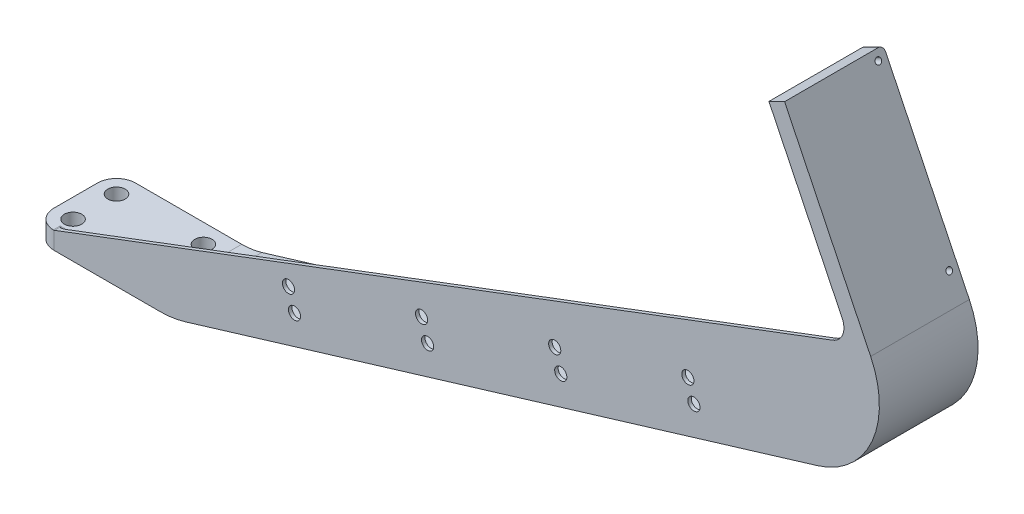
from build123d import *

# Parameters (mm, degrees)
SKETCH2_R            = 2.5000000000000004
SKETCH2_R_2          = 2.5000000000000018
BOSS_EXTRUDE1_DEPTH  = 2.5
SKETCH5_W            = 36
SKETCH5_H            = 5
SKETCH11_W           = 51.75
SKETCH11_H           = 51.75
SKETCH11_W_2         = 41.75000000000001
SKETCH11_H_2         = 41.75000000000001
BOSS_EXTRUDE2_DEPTH  = 5
SKETCH14_W           = 41.75000000000001
SKETCH14_H           = 41.75000000000003
BOSS_EXTRUDE3_DEPTH  = 1.5
FILLET1_R            = 8
SKETCH18_R           = 0.8750000000000002
CUT_EXTRUDE3_DEPTH   = 254.3041056928498
CUT_EXTRUDE4_START   = -26.0000001
CUT_EXTRUDE4_DEPTH   = 15.6250001
CUT_EXTRUDE4_START_2 = -2.5
CUT_EXTRUDE4_2_DEPTH = 88.820487138
CUT_EXTRUDE5_DEPTH   = 245.11833407729904
FILLET2_R            = 1.5
BOSS_EXTRUDE4_DEPTH  = 1
FILLET3_R            = 1
SKETCH22_R           = 1.7500000000000062
SKETCH22_R_2         = 1.750000000000084
CUT_EXTRUDE6_DEPTH   = 267.0706428279103
LPATTERN1_COUNT      = 4
LPATTERN1_PITCH      = 40
FILLET4_R            = 5


with BuildPart() as part:
    # Sketch2 → Boss-Extrude1 (new, symmetric)
    with BuildSketch(Plane(origin=(0, 0, 0), x_dir=(1, 0, 0), z_dir=(0, 1, 0))):
        with BuildLine():
            Line((-18.000000000000004, -12.5), (-18, 12.5))
            ThreePointArc((-18, 12.5), (-16.38908729652601, 16.38908729652601), (-12.5, 18.000000000000004))
            Line((-12.5, 18.000000000000004), (12.5, 17.999999999999996))
            Line((12.5, 17.999999999999996), (18.000000000000004, 17.999999999999996))
            Line((18.000000000000004, 17.999999999999996), (18.000000000000004, 12.5))
            Line((18.000000000000004, 12.5), (18.000000000000004, -12.5))
            Line((18.000000000000004, -12.5), (18.000000000000004, -18.000000000000004))
            Line((18.000000000000004, -18.000000000000004), (12.5, -18.000000000000004))
            Line((12.5, -18.000000000000004), (-12.5, -18.000000000000004))
            ThreePointArc((-12.5, -18.000000000000004), (-16.389087296526014, -16.389087296526014), (-18.000000000000004, -12.5))
        make_face()
        with Locations(Location((-12.5, 12.5, 0), (0, 0, 270))):
            Circle(SKETCH2_R, mode=Mode.SUBTRACT)
        with Locations(Location((12.5, 12.5, 0), (0, 0, 270))):
            Circle(SKETCH2_R_2, mode=Mode.SUBTRACT)
        with Locations(Location((12.5, -12.5, 0), (0, 0, 270))):
            Circle(SKETCH2_R_2, mode=Mode.SUBTRACT)
        with Locations(Location((-12.5, -12.5, 0), (0, 0, 270))):
            Circle(SKETCH2_R, mode=Mode.SUBTRACT)
        with Locations(Location((-12.5, 0, 0), (0, 0, 270))):
            Circle(SKETCH2_R, mode=Mode.SUBTRACT)
        with Locations(Location((12.5, 0, 0), (0, 0, 270))):
            Circle(SKETCH2_R, mode=Mode.SUBTRACT)
    extrude(amount=BOSS_EXTRUDE1_DEPTH, both=True)

    # Sweep2: sweep along a path in Sketch4
    with BuildLine(Plane.XY) as sweep2_path:
        Line((218.00000000000003, 97.5), (222.36301639377288, 88.50199533520518))
        ThreePointArc((222.36301639377288, 88.50199533520518), (222.77022201371398, 67.5700619217352), (207.11613369668214, 53.66822133117237))
        Line((207.11613369668214, 53.66822133117237), (25.24812896489628, -1.4262330196007162))
        ThreePointArc((25.24812896489628, -1.4262330196007162), (21.66361669051104, -2.2301013492668282), (18.000000000000004, -2.5))
    # Sketch5 → Sweep2 (sweep)
    with BuildSketch(Plane(origin=(18.000000000000004, 0, 0), x_dir=(0, 0, -1), z_dir=(1, 0, 0))):
        Rectangle(SKETCH5_W, SKETCH5_H)
    sweep(path=sweep2_path.line)

    # Sketch11 → Boss-Extrude2 (add)
    with BuildSketch(Plane(origin=(210.27969021067267, 101.96190931709863, 0), x_dir=(0, 0, 1), z_dir=(-0.8998004664794823, -0.43630163937728456, 0))):
        with Locations((-7.874999999999998, 13.491788097501477)):
            Rectangle(SKETCH11_W, SKETCH11_H)
        with Locations((-7.875000000000001, 13.491788097501482)):
            Rectangle(SKETCH11_W_2, SKETCH11_H_2, mode=Mode.SUBTRACT)
    extrude(amount=-BOSS_EXTRUDE2_DEPTH)

    # Sketch14 → Boss-Extrude3 (add)
    with BuildSketch(Plane(origin=(214.7786925430701, 104.14341751398507, 0), x_dir=(0, 0, -1), z_dir=(0.8998004664794823, 0.43630163937728456, 0))):
        with Locations((7.875000000000001, 13.491788097501479)):
            Rectangle(SKETCH14_W, SKETCH14_H)
    extrude(amount=-BOSS_EXTRUDE3_DEPTH)

    # Fillet1
    fillet1_edges = [part.edges().sort_by_distance(p)[0] for p in [
        (217.93200703068783, 91.91024356915939, -17.999999999999936),
    ]]
    fillet(fillet1_edges, radius=FILLET1_R)

    # Sketch18 → Cut-Extrude3 (cut, through all)
    with BuildSketch(Plane(origin=(210.27969021067267, 101.96190931709863, 0), x_dir=(0, 0, 1), z_dir=(-0.8998004664794823, -0.43630163937728456, 0))):
        with Locations(Location((-7.875000000000007, 36.86678809750149, 0), (0, 0, 270))):
            Circle(SKETCH18_R)
        with Locations(Location((-7.874999999999993, -9.883211902498495, 0), (0, 0, 270))):
            Circle(SKETCH18_R)
    extrude(amount=-CUT_EXTRUDE3_DEPTH, mode=Mode.SUBTRACT)

    # Cut-Extrude4: read off the stored shape, not the designer's step
    # Cut-Extrude4 outline → Cut-Extrude4 (cut)
    with BuildSketch(Plane.XY.offset(CUT_EXTRUDE4_START)):
        with BuildLine():
            ThreePointArc((207.116133697, 53.668221331), (222.268763255, 66.494633739), (223.295688181, 86.320487138))
            Line((223.295688181, 86.320487138), (217.864014061, 86.320487138))
            ThreePointArc((217.864014061, 86.320487138), (218.189778557, 69.574940408), (205.666507904, 58.453467935))
            Line((205.666507904, 58.453467935), (23.798503172, 3.359013584))
            ThreePointArc((23.798503172, 3.359013584), (20.930893352, 2.715918921), (18, 2.5))
            Line((18, 2.5), (-18, 2.5))
            Line((-18, 2.5), (-18, -2.5))
            Line((-18, -2.5), (18, -2.5))
            ThreePointArc((18, -2.5), (21.66361669, -2.230101349), (25.248128965, -1.42623302))
            Line((25.248128965, -1.42623302), (207.116133697, 53.668221331))
        make_face()
    extrude(amount=CUT_EXTRUDE4_DEPTH, mode=Mode.SUBTRACT)

    # Cut-Extrude4 2 outline → Cut-Extrude4 2 (cut)
    with BuildSketch(Plane(origin=(0, 0, 0), x_dir=(1, 0, 0), z_dir=(0, 1, 0)).offset(CUT_EXTRUDE4_START_2)):
        with BuildLine():
            ThreePointArc((-18, 0), (-16.389087297, 3.889087297), (-12.5, 5.5))
            Line((-12.5, 5.5), (196.329521381, 5.5))
            ThreePointArc((196.329521381, 5.5), (201.849371922, 6.116988496), (207.096767721, 7.9375))
            ThreePointArc((207.096767721, 7.9375), (212.34416352, 9.758011504), (217.864014061, 10.375))
            Line((217.864014061, 10.375), (13.816956719, 10.375))
            ThreePointArc((13.816956719, 10.375), (12.5, 10), (11.183043281, 10.375))
            Line((11.183043281, 10.375), (-11.183043281, 10.375))
            ThreePointArc((-11.183043281, 10.375), (-12.5, 10), (-13.816956719, 10.375))
            Line((-13.816956719, 10.375), (-18, 10.375))
            Line((-18, 10.375), (-18, 0))
        make_face()
    extrude(amount=CUT_EXTRUDE4_2_DEPTH, mode=Mode.SUBTRACT)

    # Sketch20 → Cut-Extrude5 (cut, through all)
    with BuildSketch(Plane.XZ.offset(-86.32048713831875)):
        Polygon((223.29568818087398, -10.374999999999993), (193.1038960267146, -10.374999999999996), (193.1038960267146, -33.75), (223.29568818087398, -33.74999999999999), align=None)
    extrude(amount=-CUT_EXTRUDE5_DEPTH, mode=Mode.SUBTRACT)

    # Fillet2
    fillet2_edges = [part.edges().sort_by_distance(p)[0] for p in [
        (215.07564848394176, 96.08201967202383, -10.374999999999993),
        (195.35339719291332, 138.4749177094726, -10.374999999999996),
        (196.86005503994014, 133.64868914754223, -10.374999999999996),
    ]]
    fillet(fillet2_edges, radius=FILLET2_R)

    # Sketch21 → Boss-Extrude4 (add)
    with BuildSketch(Plane.XY.offset(18.000000000000004)):
        with BuildLine():
            Line((-12.5, 2.5), (216.5551091432436, 89.01988853775721))
            Line((216.5551091432436, 89.01988853775721), (217.86401406137549, 86.32048713831875))
            ThreePointArc((217.86401406137549, 86.32048713831875), (218.18977855732837, 69.57494040754278), (205.6665079037029, 58.45346793509252))
            Line((205.6665079037029, 58.45346793509252), (23.79850317191702, 3.3590135843194235))
            ThreePointArc((23.79850317191702, 3.3590135843194235), (20.930893352408834, 2.715918920586539), (18.000000000000004, 2.5))
            Line((18.000000000000004, 2.5), (-12.5, 2.5))
        make_face()
    extrude(amount=-BOSS_EXTRUDE4_DEPTH)

    # Fillet3
    fillet3_edges = [part.edges().sort_by_distance(p)[0] for p in [
        (2.7500000000000018, 2.5, 17.000000000000004),
        (-12.5, 2.5, 17.500000000000004),
        (217.20956160230955, 87.67018783803798, 17.000000000000004),
        (218.18977855732837, 69.57494040754277, 17.000000000000004),
        (114.73250553780996, 30.906240759705973, 17.000000000000004),
        (20.93089335240883, 2.715918920586539, 17.000000000000004),
    ]]
    fillet(fillet3_edges, radius=FILLET3_R)

    # Sketch22 → Cut-Extrude6 (cut, through all)
    with BuildSketch(Plane(origin=(0, 0, 17), x_dir=(-1, 0, 0), z_dir=(0, 0, -1))):
        with Locations((-171.53351288563837, 51.24797304135555)):
            Circle(SKETCH22_R)
        with Locations((-169.79396193406333, 56.99026896605974)):
            Circle(SKETCH22_R_2)
    cut_extrude6 = extrude(amount=-CUT_EXTRUDE6_DEPTH, mode=Mode.SUBTRACT)

    # LPattern1: Cut-Extrude6 ×4
    with Locations(*[Vector(-0.9570493207840286, -0.28992515859585144, 0) * (i * LPATTERN1_PITCH) for i in range(1, LPATTERN1_COUNT)]):
        add(cut_extrude6, mode=Mode.SUBTRACT)

    # Fillet4
    fillet4_edges = [part.edges().sort_by_distance(p)[0] for p in [
        (216.55510914324364, 89.01988853775723, 17.000000000000007),
    ]]
    fillet(fillet4_edges, radius=FILLET4_R)


solid = part.part
